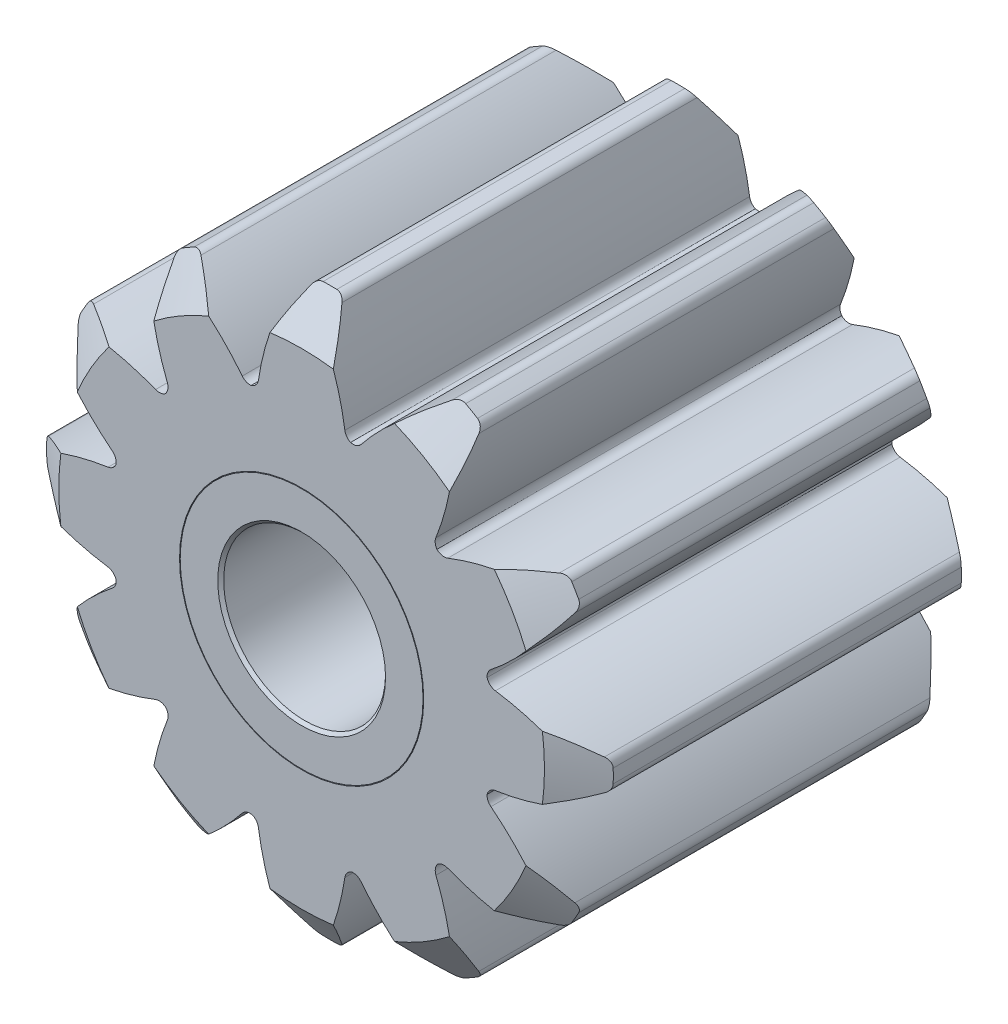
from build123d import *

# Parameters (mm, degrees)
SKETCH_11_R                 = 14.25
EXTRUDE_A_DEPTH             = 30
EXTRUDE_START               = -30
EXTRUDE_B_DEPTH             = 30
FILLET_1084_R               = 0.75
PATTERN_START               = -30
PATTERN_CIRCULAR_1492_DEPTH = 30
SKETCH_4_R                  = 24
SKETCH_4_R_2                = 18
CUT_EXTRUDE_5525_DEPTH      = 3
CUT_EXTRUDE_5525_DRAFT      = -55
CUT_EXTRUDE_START           = -30
SKETCH_4_2_R                = 24
SKETCH_4_2_R_2              = 18
CUT_EXTRUDE_2_DEPTH         = 3
CUT_EXTRUDE_2_DRAFT         = 55
SKETCH_13_R                 = 6
CUT_EXTRUDE_4_DEPTH         = 43.213742028
CHAMFER_1_SIZE              = 0.22
SKETCH_14_W                 = 15
SKETCH_14_H                 = 0.05


# Read off the part's stored shape, not the designer's step: 阵列-齿轮
with BuildPart() as part:
    # 草图11 → 拉伸-齿轮a (new body)
    with BuildSketch(Plane(origin=(-11.8785, -4, 0), x_dir=(1, 0, 0), z_dir=(0, 0, 1))):
        with Locations((11.8785, 4)):
            Circle(SKETCH_11_R)
    extrude(amount=-EXTRUDE_A_DEPTH)

    # 草图3 → 拉伸-齿轮b (add)
    with BuildSketch(Plane(origin=(-1.36106, -4, 0), x_dir=(1, 0, 0), z_dir=(0, 0, 1)).offset(EXTRUDE_START)):
        with BuildLine():
            ThreePointArc((15.23096401, 0.730709139), (15.61106, 4), (15.23096401, 7.269290861))
            ThreePointArc((15.23096401, 7.269290861), (18.89916543, 6.453138755), (22.339914397, 4.942161437))
            ThreePointArc((22.339914397, 4.942161437), (22.36106, 4), (22.339914397, 3.057838563))
            ThreePointArc((22.339914397, 3.057838563), (18.89916543, 1.546861245), (15.23096401, 0.730709139))
        make_face()
    extrude(amount=EXTRUDE_B_DEPTH)

    # Fillet 1084
    fillet_1084_edges = [part.edges().sort_by_distance(p)[0] for p in [
        (20.978854397, -0.942161437, -15),
        (13.869904011, -3.269290861, -15),
        (13.869904011, 3.269290861, -15),
        (20.978854397, 0.942161437, -15),
    ]]
    fillet(fillet_1084_edges, radius=FILLET_1084_R)

    # Pattern Circular 1492 outline → Pattern Circular 1492 (add)
    with BuildSketch(Plane.XY.offset(PATTERN_START)):
        with BuildLine():
            ThreePointArc((18.412398361, 9.301123363), (18.526054674, 9.676433389), (18.434766683, 10.057801815))
            ThreePointArc((18.434766683, 10.057801815), (18.186533479, 10.5), (17.927695219, 10.936075353))
            ThreePointArc((17.927695219, 10.936075353), (17.64306447, 11.205817285), (17.261208297, 11.295043044))
            ThreePointArc((17.261208297, 11.295043044), (13.991504573, 10.899738767), (10.836489876, 9.954693699))
            ThreePointArc((10.836489876, 9.954693699), (10.410086186, 9.917493852), (10.032774251, 10.119582048))
            ThreePointArc((10.032774251, 10.119582048), (12.310056321, 7.1780926), (13.748428396, 3.747428004))
            ThreePointArc((13.748428396, 3.747428004), (13.806959604, 4.109054667), (14.029794401, 4.399819863))
            ThreePointArc((14.029794401, 4.399819863), (16.431176225, 6.662624287), (18.412398361, 9.301123363))
        make_face()
        with BuildLine():
            ThreePointArc((13.748428396, -3.747428004), (12.340862004, -7.125), (10.119582048, -10.032774251))
            ThreePointArc((10.119582048, -10.032774251), (10.462025529, -9.902650433), (10.825252974, -9.950248429))
            ThreePointArc((10.825252974, -9.950248429), (13.985590001, -10.898503882), (17.261208297, -11.295043044))
            ThreePointArc((17.261208297, -11.295043044), (17.64306447, -11.205817285), (17.927695219, -10.936075353))
            ThreePointArc((17.927695219, -10.936075353), (18.186533479, -10.5), (18.434766683, -10.057801815))
            ThreePointArc((18.434766683, -10.057801815), (18.526054674, -9.676433389), (18.412398361, -9.301123363))
            ThreePointArc((18.412398361, -9.301123363), (16.431176225, -6.662624287), (14.029794401, -4.399819863))
            ThreePointArc((14.029794401, -4.399819863), (13.806959604, -4.109054667), (13.748428396, -3.747428004))
        make_face()
        with BuildLine():
            ThreePointArc((10.119582048, -10.032774251), (7.1780926, -12.310056321), (3.747428004, -13.748428396))
            ThreePointArc((3.747428004, -13.748428396), (4.109054667, -13.806959604), (4.399819863, -14.029794401))
            ThreePointArc((4.399819863, -14.029794401), (6.662624287, -16.431176225), (9.301123363, -18.412398361))
            ThreePointArc((9.301123363, -18.412398361), (9.676433389, -18.526054674), (10.057801815, -18.434766683))
            ThreePointArc((10.057801815, -18.434766683), (10.5, -18.186533479), (10.936075353, -17.927695219))
            ThreePointArc((10.936075353, -17.927695219), (11.205817285, -17.64306447), (11.295043044, -17.261208297))
            ThreePointArc((11.295043044, -17.261208297), (10.899738767, -13.991504573), (9.954693699, -10.836489876))
            ThreePointArc((9.954693699, -10.836489876), (9.917493852, -10.410086186), (10.119582048, -10.032774251))
        make_face()
        with BuildLine():
            ThreePointArc((3.747428004, -13.748428396), (0.061382382, -14.249867796), (-3.628846347, -13.780202255))
            ThreePointArc((-3.628846347, -13.780202255), (-3.344934075, -14.0117051), (-3.204541427, -14.350068292))
            ThreePointArc((-3.204541427, -14.350068292), (-2.445586224, -17.561128168), (-1.151190064, -20.596166407))
            ThreePointArc((-1.151190064, -20.596166407), (-0.882990203, -20.882250674), (-0.507071463, -20.993877168))
            ThreePointArc((-0.507071463, -20.993877168), (0, -21), (0.507071463, -20.993877168))
            ThreePointArc((0.507071463, -20.993877168), (0.882990203, -20.882250674), (1.151190064, -20.596166407))
            ThreePointArc((1.151190064, -20.596166407), (2.443698381, -17.566867781), (3.202772693, -14.36202237))
            ThreePointArc((3.202772693, -14.36202237), (3.383758525, -13.974146019), (3.747428004, -13.748428396))
        make_face()
        with BuildLine():
            ThreePointArc((-3.628846347, -13.780202255), (-7.071775196, -12.371438703), (-10.032774251, -10.119582048))
            ThreePointArc((-10.032774251, -10.119582048), (-9.902650433, -10.462025529), (-9.950248429, -10.825252974))
            ThreePointArc((-9.950248429, -10.825252974), (-10.898503882, -13.985590001), (-11.295043044, -17.261208297))
            ThreePointArc((-11.295043044, -17.261208297), (-11.205817285, -17.64306447), (-10.936075353, -17.927695219))
            ThreePointArc((-10.936075353, -17.927695219), (-10.5, -18.186533479), (-10.057801815, -18.434766683))
            ThreePointArc((-10.057801815, -18.434766683), (-9.676433389, -18.526054674), (-9.301123363, -18.412398361))
            ThreePointArc((-9.301123363, -18.412398361), (-6.667129013, -16.435202953), (-4.407328671, -14.039262568))
            ThreePointArc((-4.407328671, -14.039262568), (-4.056652166, -13.793844711), (-3.628846347, -13.780202255))
        make_face()
        with BuildLine():
            ThreePointArc((-10.032774251, -10.119582048), (-12.310056321, -7.1780926), (-13.748428396, -3.747428004))
            ThreePointArc((-13.748428396, -3.747428004), (-13.806959604, -4.109054667), (-14.029794401, -4.399819863))
            ThreePointArc((-14.029794401, -4.399819863), (-16.431176225, -6.662624287), (-18.412398361, -9.301123363))
            ThreePointArc((-18.412398361, -9.301123363), (-18.526054674, -9.676433389), (-18.434766683, -10.057801815))
            ThreePointArc((-18.434766683, -10.057801815), (-18.186533479, -10.5), (-17.927695219, -10.936075353))
            ThreePointArc((-17.927695219, -10.936075353), (-17.64306447, -11.205817285), (-17.261208297, -11.295043044))
            ThreePointArc((-17.261208297, -11.295043044), (-13.991504573, -10.899738767), (-10.836489876, -9.954693699))
            ThreePointArc((-10.836489876, -9.954693699), (-10.410086186, -9.917493852), (-10.032774251, -10.119582048))
        make_face()
        with BuildLine():
            ThreePointArc((-13.748428396, -3.747428004), (-14.249867796, -0.061382382), (-13.780202255, 3.628846347))
            ThreePointArc((-13.780202255, 3.628846347), (-14.0117051, 3.344934075), (-14.350068292, 3.204541427))
            ThreePointArc((-14.350068292, 3.204541427), (-17.561128168, 2.445586224), (-20.596166407, 1.151190064))
            ThreePointArc((-20.596166407, 1.151190064), (-20.882250674, 0.882990203), (-20.993877168, 0.507071463))
            ThreePointArc((-20.993877168, 0.507071463), (-21, 0), (-20.993877168, -0.507071463))
            ThreePointArc((-20.993877168, -0.507071463), (-20.882250674, -0.882990203), (-20.596166407, -1.151190064))
            ThreePointArc((-20.596166407, -1.151190064), (-17.566867781, -2.443698381), (-14.36202237, -3.202772693))
            ThreePointArc((-14.36202237, -3.202772693), (-13.974146019, -3.383758525), (-13.748428396, -3.747428004))
        make_face()
        with BuildLine():
            ThreePointArc((-13.780202255, 3.628846347), (-12.371438703, 7.071775196), (-10.119582048, 10.032774251))
            ThreePointArc((-10.119582048, 10.032774251), (-10.462025529, 9.902650433), (-10.825252974, 9.950248429))
            ThreePointArc((-10.825252974, 9.950248429), (-13.985590001, 10.898503882), (-17.261208297, 11.295043044))
            ThreePointArc((-17.261208297, 11.295043044), (-17.64306447, 11.205817285), (-17.927695219, 10.936075353))
            ThreePointArc((-17.927695219, 10.936075353), (-18.186533479, 10.5), (-18.434766683, 10.057801815))
            ThreePointArc((-18.434766683, 10.057801815), (-18.526054674, 9.676433389), (-18.412398361, 9.301123363))
            ThreePointArc((-18.412398361, 9.301123363), (-16.435202953, 6.667129013), (-14.039262568, 4.407328671))
            ThreePointArc((-14.039262568, 4.407328671), (-13.793844711, 4.056652166), (-13.780202255, 3.628846347))
        make_face()
        with BuildLine():
            ThreePointArc((-10.119582048, 10.032774251), (-7.1780926, 12.310056321), (-3.747428004, 13.748428396))
            ThreePointArc((-3.747428004, 13.748428396), (-4.109054667, 13.806959604), (-4.399819863, 14.029794401))
            ThreePointArc((-4.399819863, 14.029794401), (-6.662624287, 16.431176225), (-9.301123363, 18.412398361))
            ThreePointArc((-9.301123363, 18.412398361), (-9.676433389, 18.526054674), (-10.057801815, 18.434766683))
            ThreePointArc((-10.057801815, 18.434766683), (-10.5, 18.186533479), (-10.936075353, 17.927695219))
            ThreePointArc((-10.936075353, 17.927695219), (-11.205817285, 17.64306447), (-11.295043044, 17.261208297))
            ThreePointArc((-11.295043044, 17.261208297), (-10.899738767, 13.991504573), (-9.954693699, 10.836489876))
            ThreePointArc((-9.954693699, 10.836489876), (-9.917493852, 10.410086186), (-10.119582048, 10.032774251))
        make_face()
        with BuildLine():
            ThreePointArc((-3.747428004, 13.748428396), (-0.061382382, 14.249867796), (3.628846347, 13.780202255))
            ThreePointArc((3.628846347, 13.780202255), (3.344934075, 14.0117051), (3.204541427, 14.350068292))
            ThreePointArc((3.204541427, 14.350068292), (2.445586224, 17.561128168), (1.151190064, 20.596166407))
            ThreePointArc((1.151190064, 20.596166407), (0.882990203, 20.882250674), (0.507071463, 20.993877168))
            ThreePointArc((0.507071463, 20.993877168), (0, 21), (-0.507071463, 20.993877168))
            ThreePointArc((-0.507071463, 20.993877168), (-0.882990203, 20.882250674), (-1.151190064, 20.596166407))
            ThreePointArc((-1.151190064, 20.596166407), (-2.443698381, 17.566867781), (-3.202772693, 14.36202237))
            ThreePointArc((-3.202772693, 14.36202237), (-3.383758525, 13.974146019), (-3.747428004, 13.748428396))
        make_face()
        with BuildLine():
            ThreePointArc((3.628846347, 13.780202255), (7.071775196, 12.371438703), (10.032774251, 10.119582048))
            ThreePointArc((10.032774251, 10.119582048), (9.902650433, 10.462025529), (9.950248429, 10.825252974))
            ThreePointArc((9.950248429, 10.825252974), (10.898503882, 13.985590001), (11.295043044, 17.261208297))
            ThreePointArc((11.295043044, 17.261208297), (11.205817285, 17.64306447), (10.936075353, 17.927695219))
            ThreePointArc((10.936075353, 17.927695219), (10.5, 18.186533479), (10.057801815, 18.434766683))
            ThreePointArc((10.057801815, 18.434766683), (9.676433389, 18.526054674), (9.301123363, 18.412398361))
            ThreePointArc((9.301123363, 18.412398361), (6.667129013, 16.435202953), (4.407328671, 14.039262568))
            ThreePointArc((4.407328671, 14.039262568), (4.056652166, 13.793844711), (3.628846347, 13.780202255))
        make_face()
    extrude(amount=PATTERN_CIRCULAR_1492_DEPTH)


with BuildPart() as cut_extrude_5525_tool:
    # 草图4 → Cut-Extrude 5525 (with draft: the straight prism first)
    with BuildSketch(Plane(origin=(0, 0, -30), x_dir=(-1, 0, 0), z_dir=(0, 0, -1))):
        Circle(SKETCH_4_R)
        Circle(SKETCH_4_R_2, mode=Mode.SUBTRACT)
    extrude(amount=-CUT_EXTRUDE_5525_DEPTH)
    # Cut-Extrude 5525: the draft: its side faces are tilted about the plane it starts from
    cut_extrude_5525_sides = [cut_extrude_5525_tool.faces().sort_by_distance(p)[0] for p in [
        (24, 0, -28.5),
        (18, 0, -28.5),
    ]]
    draft(cut_extrude_5525_sides, Plane(origin=(0, 0, -30), x_dir=(-1, 0, 0), z_dir=(0, 0, -1)), CUT_EXTRUDE_5525_DRAFT)


with BuildPart() as part_1:
    add(part.part)

    # Cut-Extrude 5525: cut by cut_extrude_5525_tool
    add(cut_extrude_5525_tool.part, mode=Mode.SUBTRACT)


with BuildPart() as cut_extrude_2_tool:
    # 草图4<2> → 切除-拉伸2 (with draft: the straight prism first)
    with BuildSketch(Plane(origin=(0, 0, -30), x_dir=(-1, 0, 0), z_dir=(0, 0, -1)).offset(CUT_EXTRUDE_START)):
        Circle(SKETCH_4_2_R)
        Circle(SKETCH_4_2_R_2, mode=Mode.SUBTRACT)
    extrude(amount=CUT_EXTRUDE_2_DEPTH)
    # 切除-拉伸2: the draft: its side faces are tilted about the plane it starts from
    cut_extrude_2_sides = [cut_extrude_2_tool.faces().sort_by_distance(p)[0] for p in [
        (24, 0, -1.5),
        (18, 0, -1.5),
    ]]
    draft(cut_extrude_2_sides, Plane(origin=(0, 0, -30), x_dir=(-1, 0, 0), z_dir=(0, 0, -1)).offset(CUT_EXTRUDE_START), CUT_EXTRUDE_2_DRAFT)


with BuildPart() as part_2:
    add(part_1.part)

    # 切除-拉伸2: cut by cut_extrude_2_tool
    add(cut_extrude_2_tool.part, mode=Mode.SUBTRACT)

    # 草图13 → 切除-拉伸4 (cut, through all)
    with BuildSketch(Plane.XY):
        Circle(SKETCH_13_R)
    extrude(amount=-CUT_EXTRUDE_4_DEPTH, mode=Mode.SUBTRACT)

    # 倒角1
    chamfer_1_edges = [part_2.edges().sort_by_distance(p)[0] for p in [
        (-6, 0, -30),
        (-6, 0, 0),
    ]]
    chamfer(chamfer_1_edges, length=CHAMFER_1_SIZE)

    # 草图14 → Cut-Revolve 10488 (revolve, cut)
    with BuildSketch(Plane(origin=(0, 0, 0), x_dir=(0, 0, -1), z_dir=(1, 0, 0)), mode=Mode.PRIVATE) as cut_revolve_10488_sk:
        with Locations((30, 9.025)):
            Rectangle(SKETCH_14_W, SKETCH_14_H)
        with Locations((0, 9.025)):
            Rectangle(SKETCH_14_W, SKETCH_14_H)
    revolve(cut_revolve_10488_sk.sketch.rotate(Axis((0, 0, 0), (0, 0, -1)), 90), axis=Axis((0, 0, 0), (0, 0, -1)), mode=Mode.SUBTRACT)


solid = part_2.part
